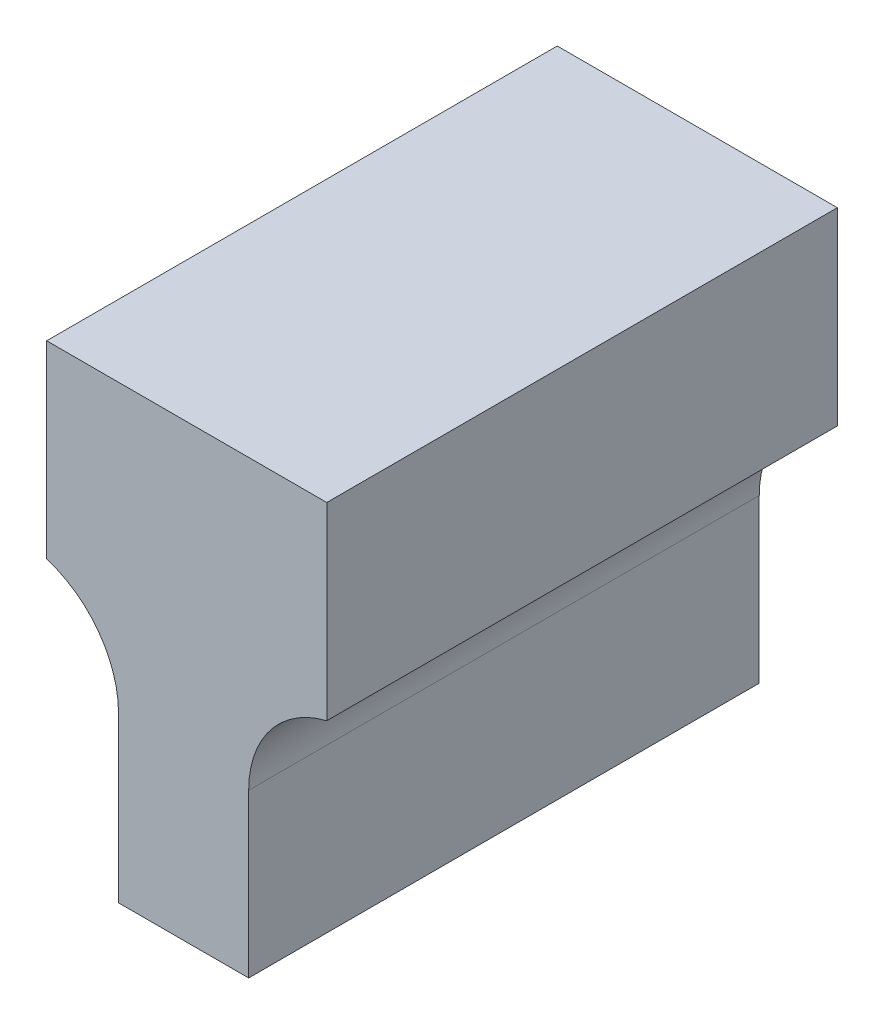
from build123d import *

# Parameters (mm, degrees)
SKETCH3_W           = 5.48566609
SKETCH3_H           = 3.701966347
SKETCH3_W_2         = 2.548907401
SKETCH3_H_2         = 5.128177147
BOSS_EXTRUDE2_DEPTH = 10
FILLET1_R           = 2


with BuildPart() as part:
    # Sketch3 → Boss-Extrude2 (new body)
    with BuildSketch(Plane.XY):
        with Locations((2.742833045, 1.850983174)):
            Rectangle(SKETCH3_W, SKETCH3_H)
        with Locations((2.68186795, -2.564088574)):
            Rectangle(SKETCH3_W_2, SKETCH3_H_2)
    extrude(amount=BOSS_EXTRUDE2_DEPTH)

    # Fillet1
    # the kernel refuses this fillet: 2 mm, written as the material it adds along each edge
    with BuildSketch(Plane(origin=(3.95632165, 0, 0), x_dir=(1, 0, 0), z_dir=(0, 0, 1))) as fillet1_piece_1:
        with BuildLine():
            CenterArc((2, -1.943832129), FILLET1_R, 103.610945059, 76.389054941)
            Line((0, -1.943832129), (-0.04, -1.943832129))
            Line((-0.04, -1.943832129), (-0.04, 0))
            Line((-0.04, 0), (0, 0.04))
            ThreePointArc((0, 0.04), (0.76467222, 0.04), (1.519931329, 0.038876643))
            Line((1.519931329, 0.038876643), (1.52934444, 0))
        make_face()
    extrude(amount=10)
    with BuildSketch(Plane(origin=(1.407414249, 0, 0), x_dir=(-1, 0, 0), z_dir=(0, 0, 1))) as fillet1_piece_2:
        with BuildLine():
            CenterArc((2, 1.910194265), FILLET1_R, 180, 72.764919968)
            Line((0, 1.910194265), (-0.04, 1.910194265))
            Line((-0.04, 1.910194265), (-0.04, 0))
            Line((-0.04, 0), (0, -0.04))
            ThreePointArc((0, -0.04), (0.703707125, -0.04), (1.395562534, -0.038203885))
            Line((1.395562534, -0.038203885), (1.407414249, 0))
        make_face()
    extrude(amount=10)


solid = part.part
